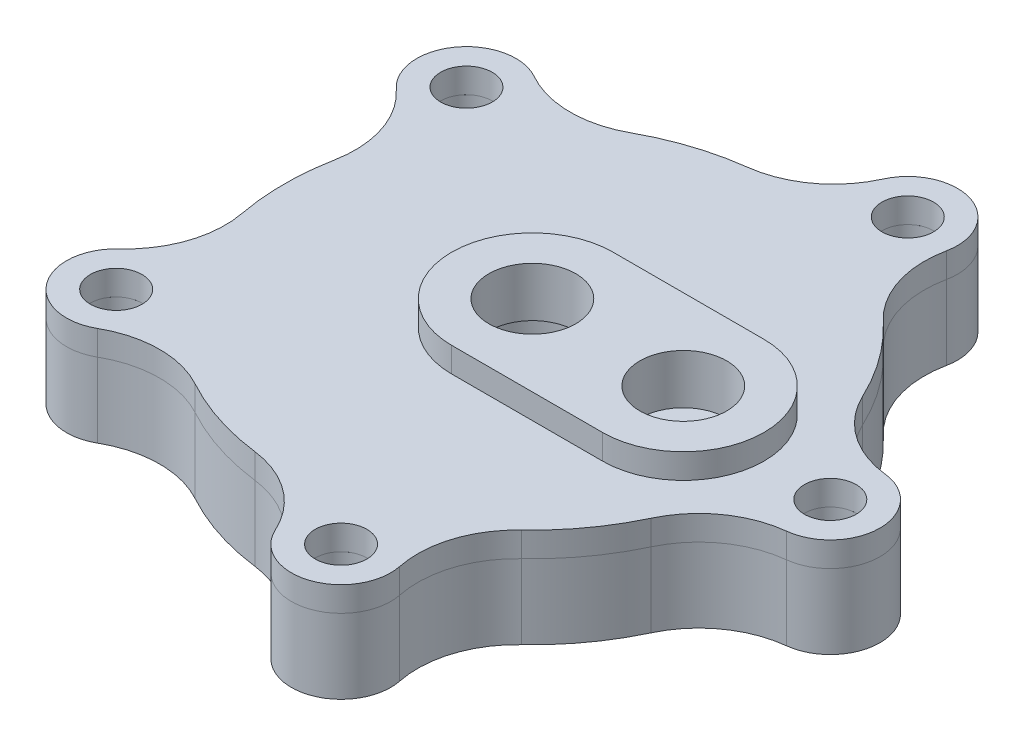
from build123d import *

# Parameters (mm, degrees)
SKETCH1_W           = 7.62
SKETCH1_H           = 3.175
SKETCH2_R           = 3.302
BOSS_EXTRUDE1_DEPTH = 3.175
BOSS_EXTRUDE2_START = -3.175
SKETCH2_4_R         = 3.302
BOSS_EXTRUDE2_DEPTH = 9.525
FILLET1_R           = 12.7
CIRPATTERN1_COUNT   = 3
SKETCH3_R           = 5.55625
BOSS_EXTRUDE3_DEPTH = 3.175
SKETCH3_3_R         = 5.55625
CUT_EXTRUDE1_DEPTH  = 3.175
FILLET3_R           = 12.7
SKETCH4_R           = 22.2885
SKETCH4_R_2         = 19.6723
CUT_EXTRUDE3_DEPTH  = 2.286


with BuildPart() as part:
    # Sketch1 → Revolve1 (revolve)
    with BuildSketch(Plane.XY, mode=Mode.PRIVATE) as revolve1_sk:
        Polygon((0, 0), (4.421499231, 0), (2.588412127, 3.175), (0, 3.175), align=None)
        Polygon((4.421499231, 0), (5.008087105, 0), (3.175, 3.175), (2.588412127, 3.175), align=None)
        Polygon((5.008087105, 0), (5.594674978, 0), (3.761587873, 3.175), (3.175, 3.175), align=None)
        Polygon((10.39407951, 0), (13.56907951, 3.175), (11.1125, 3.175), (6.35, 3.175), (3.761587873, 3.175), (5.594674978, 0), align=None)
        Polygon((11.1125, 3.175), (11.1125, 6.35), (9.641614902, 6.35), (9.641614902, 5.212346408), (8.054114902, 5.212346408), (8.054114902, 6.35), (6.35, 6.35), (6.35, 3.175), align=None)
        Polygon((11.1125, 0), (14.2875, 3.175), (13.56907951, 3.175), (10.39407951, 0), align=None)
        Polygon((11.83092049, 0), (15.00592049, 3.175), (14.2875, 3.175), (11.1125, 0), align=None)
        Polygon((31.75, 0), (31.75, 3.175), (26.9875, 3.175), (15.00592049, 3.175), (11.83092049, 0), (24.13, 0), align=None)
        Polygon((26.9875, 3.175), (31.75, 3.175), (31.75, 6.35), (30.162975205, 6.35), (30.162975205, 5.212346408), (28.575475205, 5.212346408), (28.575475205, 6.35), (26.9875, 6.35), align=None)
        with Locations((27.94, -1.5875)):
            Rectangle(SKETCH1_W, SKETCH1_H)
    revolve(revolve1_sk.sketch.rotate(Axis((0, 3.175, 0), (0, -1, 0)), 180), axis=Axis((0, 3.175, 0), (0, -1, 0)))

    # Sketch2<4> → Boss-Extrude2 (add)
    # profile 1 of 5: a face of its own
    with BuildSketch(Plane(origin=(0, 9.525, 0), x_dir=(1, 0, 0), z_dir=(0, 1, 0)).offset(BOSS_EXTRUDE2_START)):
        with BuildLine():
            ThreePointArc((31.108519733, 6.35), (31.75, 0), (31.108519733, -6.35))
            Line((31.108519733, -6.35), (38.1, -6.35))
            ThreePointArc((38.1, -6.35), (44.45, 0), (38.1, 6.35))
            Line((38.1, 6.35), (31.108519733, 6.35))
        make_face()
        with Locations(Location((38.1, 0, 0), (0, 0, 180))):
            Circle(SKETCH2_4_R, mode=Mode.SUBTRACT)
    # profile 2 of 5: a face of its own
    with BuildSketch(Plane(origin=(0, 9.525, 0), x_dir=(1, 0, 0), z_dir=(0, 1, 0)).offset(BOSS_EXTRUDE2_START)):
        with BuildLine():
            Line((15.652270146, 27.62370249), (17.812756364, 34.272995357))
            ThreePointArc((17.812756364, 34.272995357), (13.7358054, 42.274462149), (5.734338607, 38.197511185))
            Line((5.734338607, 38.197511185), (3.573852389, 31.548218319))
            ThreePointArc((3.573852389, 31.548218319), (9.811289571, 30.196044392), (15.652270146, 27.62370249))
        make_face()
        with Locations(Location((11.773547486, 36.235253271, 0), (0, 0, 180))):
            Circle(SKETCH2_4_R, mode=Mode.SUBTRACT)
    # profile 3 of 5: a face of its own
    with BuildSketch(Plane(origin=(0, 9.525, 0), x_dir=(1, 0, 0), z_dir=(0, 1, 0)).offset(BOSS_EXTRUDE2_START)):
        with BuildLine():
            Line((17.812756364, -34.272995357), (15.652270146, -27.62370249))
            ThreePointArc((15.652270146, -27.62370249), (9.811289571, -30.196044392), (3.573852389, -31.548218319))
            Line((3.573852389, -31.548218319), (5.734338607, -38.197511185))
            ThreePointArc((5.734338607, -38.197511185), (13.7358054, -42.274462149), (17.812756364, -34.272995357))
        make_face()
        with Locations(Location((11.773547486, -36.235253271, 0), (0, 0, 180))):
            Circle(SKETCH2_4_R, mode=Mode.SUBTRACT)
    # profile 4 of 5: a face of its own
    with BuildSketch(Plane(origin=(0, 9.525, 0), x_dir=(1, 0, 0), z_dir=(0, 1, 0)).offset(BOSS_EXTRUDE2_START)):
        with BuildLine():
            Line((-21.434884782, 23.422387034), (-27.091111134, 27.531876027))
            ThreePointArc((-27.091111134, 27.531876027), (-35.9608054, 26.127054464), (-34.555983838, 17.257360198))
            Line((-34.555983838, 17.257360198), (-28.899757486, 13.147871206))
            ThreePointArc((-28.899757486, 13.147871206), (-25.686289571, 18.66218176), (-21.434884782, 23.422387034))
        make_face()
        with Locations(Location((-30.823547486, 22.394618112, 0), (0, 0, 180))):
            Circle(SKETCH2_4_R, mode=Mode.SUBTRACT)
    # profile 5 of 5: a face of its own
    with BuildSketch(Plane(origin=(0, 9.525, 0), x_dir=(1, 0, 0), z_dir=(0, 1, 0)).offset(BOSS_EXTRUDE2_START)):
        with BuildLine():
            Line((-27.091111134, -27.531876027), (-21.434884782, -23.422387034))
            ThreePointArc((-21.434884782, -23.422387034), (-25.686289571, -18.66218176), (-28.899757486, -13.147871206))
            Line((-28.899757486, -13.147871206), (-34.555983838, -17.257360198))
            ThreePointArc((-34.555983838, -17.257360198), (-35.9608054, -26.127054464), (-27.091111134, -27.531876027))
        make_face()
        with Locations(Location((-30.823547486, -22.394618112, 0), (0, 0, 180))):
            Circle(SKETCH2_4_R, mode=Mode.SUBTRACT)
    extrude(amount=-BOSS_EXTRUDE2_DEPTH)

    # Sketch1<6> → Cut-Revolve1 (revolve, cut)
    with BuildSketch(Plane.XY):
        Polygon((11.83092049, 0), (15.00592049, 3.175), (14.2875, 3.175), (11.1125, 0), align=None)
        Polygon((11.1125, -0.71842049), (11.83092049, 0), (11.1125, 0), (10.753289755, -0.359210245), align=None)
    cut_revolve1 = revolve(axis=Axis((14.2875, 3.175, 0), (-0.7071067811865461, -0.707106781186549, 0)), mode=Mode.SUBTRACT)

    # Sketch1<7> → Cut-Revolve2 (revolve, cut)
    with BuildSketch(Plane.XY):
        Polygon((4.421499231, 0), (5.008087105, 0), (3.175, 3.175), (2.588412127, 3.175), align=None)
        Polygon((5.154734073, -0.254), (5.008087105, 0), (4.421499231, 0), (4.714793168, -0.508), align=None)
    cut_revolve2 = revolve(axis=Axis((3.175, 3.175, 0), (0.5000000000000047, -0.8660254037844359, 0)), mode=Mode.SUBTRACT)

    # CirPattern1: Cut-Revolve1, Cut-Revolve2 ×3 about axis
    cirpattern1_axis = Axis((0, -3.175, 0), (0, 1, 0))
    add([cut_revolve1.rotate(cirpattern1_axis, i * 360 / CIRPATTERN1_COUNT) for i in range(1, CIRPATTERN1_COUNT)], mode=Mode.SUBTRACT)
    add([cut_revolve2.rotate(cirpattern1_axis, i * 360 / CIRPATTERN1_COUNT) for i in range(1, CIRPATTERN1_COUNT)], mode=Mode.SUBTRACT)

    # Fillet3
    # the kernel refuses this fillet: 12.7 mm, written as the material it adds along each edge
    with BuildSketch(Plane(origin=(15.652270146, 6.35, -27.62370249), x_dir=(0.8051747766979301, 0, 0.5930375864727617), z_dir=(0, -1, 0)), Plane(origin=(31.108519733, 6.35, 6.35), x_dir=(-0.315199571581157, 0, 0.9490254106582474), z_dir=(0, -1, 0)), Plane(origin=(3.573852389, 6.35, 31.548218319), x_dir=(-0.9999788251744905, 0, -0.00650762649863798), z_dir=(0, -1, 0)), Plane(origin=(-28.899757486, 6.35, 13.147871206), x_dir=(-0.3028213304068675, 0, -0.9530473450204952), z_dir=(0, -1, 0)), Plane(origin=(-21.434884782, 6.35, -23.422387034), x_dir=(0.812824950464584, 0, -0.5825080256118763), z_dir=(0, -1, 0))) as fillet3_piece_1:
        with BuildLine():
            CenterArc((9.069793764, -12.609717198), FILLET3_R, 96.835903132, 58.411864495)
            Line((-2.463417374, -7.292289167), (-3.616738488, -6.760546364))
            ThreePointArc((-3.616738488, -6.760546364), (-3.408973856, -6.234788975), (-1.205262272, 0.400303456))
            Line((-1.205262272, 0.400303456), (0.151163229, 1.26097172))
            ThreePointArc((0.151163229, 1.26097172), (3.779080735, 1.044292994), (7.40699824, 1.26097172))
            Line((7.40699824, 1.26097172), (7.55816147, 0))
        make_face()
    extrude(amount=9.525)
    with BuildSketch(Plane(origin=(3.573852389, 6.35, -31.548218319), x_dir=(0.31387124232172303, 0, -0.9494655566387957), z_dir=(0, -1, 0)), Plane(origin=(31.108519733, 6.35, -6.35), x_dir=(0.9999869525621216, 0, 0.005108297712671891), z_dir=(0, -1, 0)), Plane(origin=(15.652270146, 6.35, 27.62370249), x_dir=(0.3041546826680995, 0, 0.95262265824988), z_dir=(0, -1, 0)), Plane(origin=(-21.434884782, 6.35, 23.422387034), x_dir=(-0.8120090208357984, 0, 0.58364488353903), z_dir=(0, -1, 0))) as fillet3_piece_2:
        with BuildLine():
            CenterArc((9.043755278, -12.628405172), FILLET3_R, 96.086685036, 58.411864495)
            Line((-2.418939418, -7.160624058), (-3.565208887, -6.613845946))
            ThreePointArc((-3.565208887, -6.613845946), (-2.198835915, -3.246092987), (-1.243027046, 0.260353149))
            Line((-1.243027046, 0.260353149), (0.006487538, 1.26998343))
            ThreePointArc((0.006487538, 1.26998343), (6.997876584, 1.234268867), (7.562474347, 1.262840517))
            Line((7.562474347, 1.262840517), (7.69713625, 0))
        make_face()
    extrude(amount=9.525)
    with BuildSketch(Plane(origin=(-28.899757486, 6.35, -13.147871206), x_dir=(-0.3028213304068674, 0, 0.9530473450204953), z_dir=(0, -1, 0))) as fillet3_piece_3:
        with BuildLine():
            CenterArc((9.069793764, 12.609717198), FILLET3_R, 204.752232373, 58.411864495)
            Line((-2.463417374, 7.292289167), (-3.616738488, 6.760546364))
            ThreePointArc((-3.616738488, 6.760546364), (-3.408973856, 6.234788975), (-1.205262272, -0.400303456))
            Line((-1.205262272, -0.400303456), (0.151163229, -1.26097172))
            ThreePointArc((0.151163229, -1.26097172), (3.779080735, -1.044292994), (7.40699824, -1.26097172))
            Line((7.40699824, -1.26097172), (7.55816147, 0))
        make_face()
    extrude(amount=9.525)

    # Sketch4 → Cut-Extrude3 (cut)
    with BuildSketch(Plane(origin=(0, 0, 0), x_dir=(-1, 0, 0), z_dir=(0, -1, 0))):
        with Locations(Location((0, 0, 0), (0, 0, 180))):
            Circle(SKETCH4_R)
        with Locations(Location((0, 0, 0), (0, 0, 180))):
            Circle(SKETCH4_R_2, mode=Mode.SUBTRACT)
    extrude(amount=-CUT_EXTRUDE3_DEPTH, mode=Mode.SUBTRACT)


with BuildPart() as body_2:
    # Sketch1<3> → Revolve2 (revolve)
    with BuildSketch(Plane.XY, mode=Mode.PRIVATE) as revolve2_sk:
        Polygon((6.35, 6.35), (11.1125, 6.35), (26.9875, 6.35), (31.75, 6.35), (31.75, 9.525), (5.55625, 9.525), (5.55625, 6.35), align=None)
    revolve(revolve2_sk.sketch.rotate(Axis((0, 3.175, 0), (0, -1, 0)), 180), axis=Axis((0, 3.175, 0), (0, -1, 0)))

    # Sketch2 → Boss-Extrude1 (add)
    # profile 1 of 5: a face of its own
    with BuildSketch(Plane(origin=(0, 9.525, 0), x_dir=(1, 0, 0), z_dir=(0, 1, 0))):
        with BuildLine():
            ThreePointArc((31.108519733, 6.35), (31.75, 0), (31.108519733, -6.35))
            Line((31.108519733, -6.35), (38.1, -6.35))
            ThreePointArc((38.1, -6.35), (44.45, 0), (38.1, 6.35))
            Line((38.1, 6.35), (31.108519733, 6.35))
        make_face()
        with Locations(Location((38.1, 0, 0), (0, 0, 180))):
            Circle(SKETCH2_R, mode=Mode.SUBTRACT)
    # profile 2 of 5: a face of its own
    with BuildSketch(Plane(origin=(0, 9.525, 0), x_dir=(1, 0, 0), z_dir=(0, 1, 0))):
        with BuildLine():
            Line((15.652270146, 27.62370249), (17.812756364, 34.272995357))
            ThreePointArc((17.812756364, 34.272995357), (13.7358054, 42.274462149), (5.734338607, 38.197511185))
            Line((5.734338607, 38.197511185), (3.573852389, 31.548218319))
            ThreePointArc((3.573852389, 31.548218319), (9.811289571, 30.196044392), (15.652270146, 27.62370249))
        make_face()
        with Locations(Location((11.773547486, 36.235253271, 0), (0, 0, 180))):
            Circle(SKETCH2_R, mode=Mode.SUBTRACT)
    # profile 3 of 5: a face of its own
    with BuildSketch(Plane(origin=(0, 9.525, 0), x_dir=(1, 0, 0), z_dir=(0, 1, 0))):
        with BuildLine():
            Line((17.812756364, -34.272995357), (15.652270146, -27.62370249))
            ThreePointArc((15.652270146, -27.62370249), (9.811289571, -30.196044392), (3.573852389, -31.548218319))
            Line((3.573852389, -31.548218319), (5.734338607, -38.197511185))
            ThreePointArc((5.734338607, -38.197511185), (13.7358054, -42.274462149), (17.812756364, -34.272995357))
        make_face()
        with Locations(Location((11.773547486, -36.235253271, 0), (0, 0, 180))):
            Circle(SKETCH2_R, mode=Mode.SUBTRACT)
    # profile 4 of 5: a face of its own
    with BuildSketch(Plane(origin=(0, 9.525, 0), x_dir=(1, 0, 0), z_dir=(0, 1, 0))):
        with BuildLine():
            Line((-21.434884782, 23.422387034), (-27.091111134, 27.531876027))
            ThreePointArc((-27.091111134, 27.531876027), (-35.9608054, 26.127054464), (-34.555983838, 17.257360198))
            Line((-34.555983838, 17.257360198), (-28.899757486, 13.147871206))
            ThreePointArc((-28.899757486, 13.147871206), (-25.686289571, 18.66218176), (-21.434884782, 23.422387034))
        make_face()
        with Locations(Location((-30.823547486, 22.394618112, 0), (0, 0, 180))):
            Circle(SKETCH2_R, mode=Mode.SUBTRACT)
    # profile 5 of 5: a face of its own
    with BuildSketch(Plane(origin=(0, 9.525, 0), x_dir=(1, 0, 0), z_dir=(0, 1, 0))):
        with BuildLine():
            Line((-27.091111134, -27.531876027), (-21.434884782, -23.422387034))
            ThreePointArc((-21.434884782, -23.422387034), (-25.686289571, -18.66218176), (-28.899757486, -13.147871206))
            Line((-28.899757486, -13.147871206), (-34.555983838, -17.257360198))
            ThreePointArc((-34.555983838, -17.257360198), (-35.9608054, -26.127054464), (-27.091111134, -27.531876027))
        make_face()
        with Locations(Location((-30.823547486, -22.394618112, 0), (0, 0, 180))):
            Circle(SKETCH2_R, mode=Mode.SUBTRACT)
    extrude(amount=-BOSS_EXTRUDE1_DEPTH)

    # Fillet1
    fillet1_edges = [body_2.edges().sort_by_distance(p)[0] for p in [
        (-21.434884782, 7.9375, 23.422387034),
        (3.573852389, 7.9375, 31.548218319),
        (15.652270146, 7.9375, 27.62370249),
        (31.108519733, 7.9375, 6.35),
        (31.108519733, 7.9375, -6.35),
        (15.652270146, 7.9375, -27.62370249),
        (3.573852389, 7.9375, -31.548218319),
        (-21.434884782, 7.9375, -23.422387034),
        (-28.899757486, 7.9375, 13.147871206),
        (-28.899757486, 7.9375, -13.147871206),
    ]]
    fillet(fillet1_edges, radius=FILLET1_R)

    # Sketch3 → Boss-Extrude3 (add)
    with BuildSketch(Plane(origin=(0, 9.525, 0), x_dir=(1, 0, 0), z_dir=(0, 1, 0))):
        with BuildLine():
            Line((19.304, 10.31875), (0, 10.31875))
            ThreePointArc((0, 10.31875), (-10.31875, 0), (0, -10.31875))
            Line((0, -10.31875), (19.304, -10.31875))
            ThreePointArc((19.304, -10.31875), (29.62275, 0), (19.304, 10.31875))
        make_face()
        with Locations(Location((19.304, 0, 0), (0, 0, 180))):
            Circle(SKETCH3_R, mode=Mode.SUBTRACT)
        with Locations(Location((0, 0, 0), (0, 0, 180))):
            Circle(SKETCH3_R, mode=Mode.SUBTRACT)
    extrude(amount=BOSS_EXTRUDE3_DEPTH)

    # Sketch3<3> → Cut-Extrude1 (cut)
    with BuildSketch(Plane(origin=(0, 9.525, 0), x_dir=(1, 0, 0), z_dir=(0, 1, 0))):
        with Locations(Location((19.304, 0, 0), (0, 0, 180))):
            Circle(SKETCH3_3_R)
    extrude(amount=-CUT_EXTRUDE1_DEPTH, mode=Mode.SUBTRACT)


solid = Compound([part.part, body_2.part])
